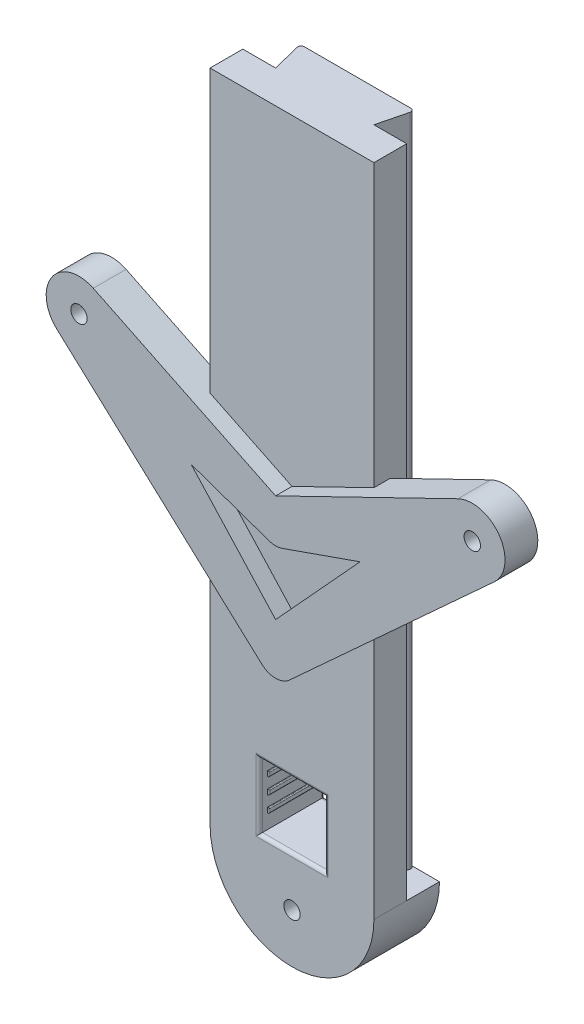
from build123d import *

# Parameters (mm, degrees)
EXTRUDE_1_DEPTH        = 40
FILLET_1_R             = 0.2
EXTRUDE_2_DEPTH        = 4
SKETCH_3_R             = 0.5
SKETCH_3_W             = 4
SKETCH_3_H             = 4
CUT_EXTRUDE_1_DEPTH    = 4
FILLET_2_R             = 0.2
SKETCH_4_W             = 3
SKETCH_4_H             = 0.3
EXTRUDE_3_DEPTH        = 0.1
FILLET_3_R             = 0.05
FILLET_3_OF_MIRROR_1_R = 0.05
SKETCH_7_R             = 0.5
EXTRUDE_4_DEPTH        = 1


with BuildPart() as part:
    # 草图1 → 凸台-拉伸1 (new body)
    with BuildSketch(Plane(origin=(0, 0, 0), x_dir=(1, 0, 0), z_dir=(0, 1, 0))):
        Polygon((3.5, 2), (-3.5, 2), (-3, 0), (-5, 0), (-5, -2), (5, -2), (5, 0), (3, 0), align=None)
    extrude(amount=EXTRUDE_1_DEPTH)

    # 圆角1
    fillet_1_edges = [part.edges().sort_by_distance(p)[0] for p in [
        (3.5, 20, -2),
        (-3.5, 20, -2),
    ]]
    fillet(fillet_1_edges, radius=FILLET_1_R)

    # 草图2 → 凸台-拉伸2 (add)
    with BuildSketch(Plane.XY.offset(2)):
        with BuildLine():
            Line((-5, 0), (5, 0))
            ThreePointArc((5, 0), (0, -5), (-5, 0))
        make_face()
    extrude(amount=-EXTRUDE_2_DEPTH)

    # 草图3 → 切除-拉伸1 (cut)
    with BuildSketch(Plane.XY.offset(2)):
        with Locations((0, -2)):
            Circle(SKETCH_3_R)
        with Locations((0, 3)):
            Rectangle(SKETCH_3_W, SKETCH_3_H)
    extrude(amount=-CUT_EXTRUDE_1_DEPTH, mode=Mode.SUBTRACT)

    # 圆角2
    fillet_2_edges = [part.edges().sort_by_distance(p)[0] for p in [
        (0, 1, -2),
        (2, 3, -2),
        (0, 5, -2),
        (-2, 3, -2),
        (-2, 3, 2),
        (0, 5, 2),
        (0, 1, 2),
        (2, 3, 2),
    ]]
    fillet(fillet_2_edges, radius=FILLET_2_R)

    # 草图4 → 凸台-拉伸3 (add)
    with BuildSketch(Plane(origin=(-2, 0, 0), x_dir=(0, 0, -1), z_dir=(1, 0, 0))):
        with Locations((0, 3)):
            Rectangle(SKETCH_4_W, SKETCH_4_H)
        with Locations((0, 2.035809375)):
            Rectangle(SKETCH_4_W, SKETCH_4_H)
        with Locations((0, 3.964190625)):
            Rectangle(SKETCH_4_W, SKETCH_4_H)
    extrude_3 = extrude(amount=EXTRUDE_3_DEPTH)

    # 圆角3
    fillet_3_edges = [part.edges().sort_by_distance(p)[0] for p in [
        (-1.9, 2.035809375, 1.5),
        (-1.9, 1.885809375, 0),
        (-1.9, 2.035809375, -1.5),
        (-1.9, 2.185809375, 0),
        (-1.9, 3, 1.5),
        (-1.9, 2.85, 0),
        (-1.9, 3.15, 0),
        (-1.9, 3, -1.5),
        (-1.9, 3.964190625, 1.5),
        (-1.9, 4.114190625, 0),
        (-1.9, 3.814190625, 0),
        (-1.9, 3.964190625, -1.5),
    ]]
    fillet(fillet_3_edges, radius=FILLET_3_R)

    # 镜向1: 凸台-拉伸3 across plane
    add(extrude_3.mirror(Plane(origin=(0, 0, 0), x_dir=(0, 0, 1), z_dir=(1, 0, 0))))

    # 圆角3 of 镜向1
    fillet_3_of_mirror_1_edges = [part.edges().sort_by_distance(p)[0] for p in [
        (1.9, 2.035809375, 1.5),
        (1.9, 1.885809375, 0),
        (1.9, 2.035809375, -1.5),
        (1.9, 2.185809375, 0),
        (1.9, 3, 1.5),
        (1.9, 2.85, 0),
        (1.9, 3.15, 0),
        (1.9, 3, -1.5),
        (1.9, 3.964190625, 1.5),
        (1.9, 4.114190625, 0),
        (1.9, 3.814190625, 0),
        (1.9, 3.964190625, -1.5),
    ]]
    fillet(fillet_3_of_mirror_1_edges, radius=FILLET_3_OF_MIRROR_1_R)

    # 草图7 → 凸台-拉伸4 (add, symmetric)
    with BuildSketch(Plane.XY.offset(2)):
        with BuildLine():
            Line((0, 20.389892534), (-11.125541577, 25.798700216))
            ThreePointArc((-11.125541577, 25.798700216), (-13.654217433, 25.124083932), (-13.350331819, 22.524668181))
            Line((-13.350331819, 22.524668181), (-0.843957387, 11.077917613))
            ThreePointArc((-0.843957387, 11.077917613), (0, 10.75), (0.843957387, 11.077917613))
            Line((0.843957387, 11.077917613), (13.350331819, 22.524668181))
            ThreePointArc((13.350331819, 22.524668181), (13.654217433, 25.124083932), (11.125541577, 25.798700216))
            Line((11.125541577, 25.798700216), (0, 20.389892534))
        make_face()
        with BuildLine():
            Line((0.41340042, 17.820338992), (5.152831779, 19.481225383))
            Line((5.152831779, 19.481225383), (0, 13.851396793))
            Line((0, 13.851396793), (-5.152831779, 19.481225383))
            Line((-5.152831779, 19.481225383), (-0.41340042, 17.820338992))
            ThreePointArc((-0.41340042, 17.820338992), (0, 17.75), (0.41340042, 17.820338992))
        make_face(mode=Mode.SUBTRACT)
        with Locations((12, 24)):
            Circle(SKETCH_7_R, mode=Mode.SUBTRACT)
        with Locations((-12, 24)):
            Circle(SKETCH_7_R, mode=Mode.SUBTRACT)
    extrude(amount=EXTRUDE_4_DEPTH, both=True)


solid = part.part
